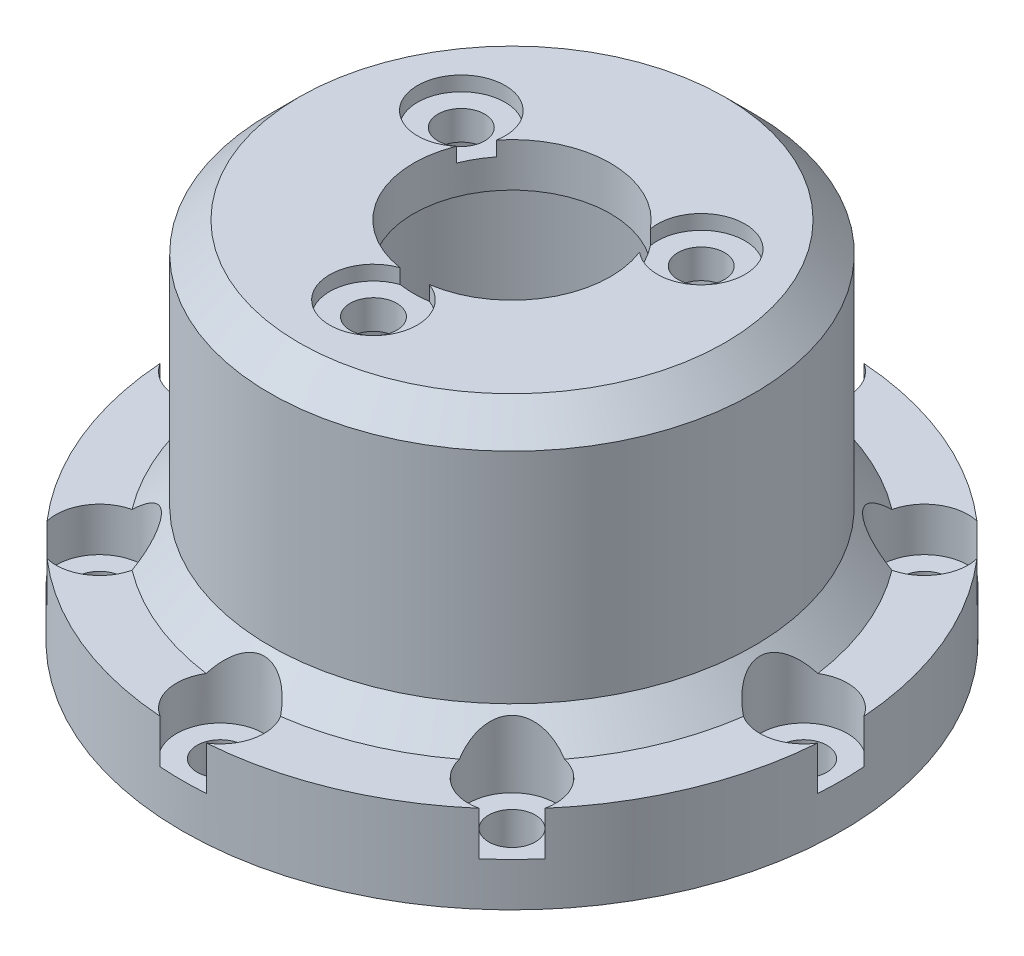
from build123d import *

# Parameters (mm, degrees)
SKETCH_2_R               = 1.6
CUT_EXTRUDE_1_DEPTH      = 8
PATTERN_CIRCULAR_1_COUNT = 8
SKETCH_3_R               = 1.6
CUT_EXTRUDE_2_DEPTH      = 10
SKETCH_4_R               = 3
CUT_EXTRUDE_6_DEPTH      = 3
PATTERN_CIRCULAR_2_COUNT = 8
SKETCH_5_R               = 3
CUT_EXTRUDE_7_DEPTH      = 1
PATTERN_CIRCULAR_3_COUNT = 3
CHAMFER_1_SIZE           = 2


with BuildPart() as part:
    # 草图1 → 旋转1 (revolve)
    with BuildSketch(Plane.XY, mode=Mode.PRIVATE) as revolve_1_sk:
        Polygon((-14, 0), (-16.6, 0), (-16.6, 3), (-22.6, 3), (-22.6, 9), (-16.6, 9), (-16.6, 28), (-6.75, 28), (-6.75, 25), (-14, 25), align=None)
    revolve(revolve_1_sk.sketch.rotate(Axis((0, 0, 0), (0, 1, 0)), 270), axis=Axis((0, 0, 0), (0, 1, 0)))

    # 草图2 → 切除-拉伸1 (cut)
    with BuildSketch(Plane.XZ.offset(-3)):
        with Locations(Location((0, -20, 0), (0, 0, 270))):
            Circle(SKETCH_2_R)
    cut_extrude_1 = extrude(amount=-CUT_EXTRUDE_1_DEPTH, mode=Mode.SUBTRACT)

    # 阵列(圆周)1: 切除-拉伸1 ×8 about axis
    pattern_circular_1_axis = Axis((0, 0, 0), (0, 1, 0))
    for i in range(1, PATTERN_CIRCULAR_1_COUNT):
        add(cut_extrude_1.rotate(pattern_circular_1_axis, i * 360 / PATTERN_CIRCULAR_1_COUNT), mode=Mode.SUBTRACT)

    # 草图3 → 切除-拉伸2 (cut)
    with BuildSketch(Plane(origin=(0, 28, 0), x_dir=(1, 0, 0), z_dir=(0, 1, 0))):
        with Locations(Location((0, -9.5, 0), (0, 0, 270))):
            Circle(SKETCH_3_R)
        with Locations(Location((-8.227241336, 4.75, 0), (0, 0, 270))):
            Circle(SKETCH_3_R)
        with Locations(Location((8.227241336, 4.75, 0), (0, 0, 270))):
            Circle(SKETCH_3_R)
    extrude(amount=-CUT_EXTRUDE_2_DEPTH, mode=Mode.SUBTRACT)

    # 草图4 → 切除-拉伸6 (cut)
    with BuildSketch(Plane(origin=(0, 9, 0), x_dir=(1, 0, 0), z_dir=(0, 1, 0))):
        with Locations((20, 0)):
            Circle(SKETCH_4_R)
    cut_extrude_6 = extrude(amount=-CUT_EXTRUDE_6_DEPTH, mode=Mode.SUBTRACT)

    # 阵列(圆周)2: 切除-拉伸6 ×8 about axis
    pattern_circular_2_axis = Axis((0, 0, 0), (0, 1, 0))
    for i in range(1, PATTERN_CIRCULAR_2_COUNT):
        add(cut_extrude_6.rotate(pattern_circular_2_axis, i * 360 / PATTERN_CIRCULAR_2_COUNT), mode=Mode.SUBTRACT)

    # 草图5 → 切除-拉伸7 (cut)
    with BuildSketch(Plane(origin=(0, 28, 0), x_dir=(1, 0, 0), z_dir=(0, 1, 0))):
        with Locations((8.227241336, 4.75)):
            Circle(SKETCH_5_R)
    cut_extrude_7 = extrude(amount=-CUT_EXTRUDE_7_DEPTH, mode=Mode.SUBTRACT)

    # 阵列(圆周)3: 切除-拉伸7 ×3 about axis
    pattern_circular_3_axis = Axis((0, 0, 0), (0, 1, 0))
    for i in range(1, PATTERN_CIRCULAR_3_COUNT):
        add(cut_extrude_7.rotate(pattern_circular_3_axis, i * 360 / PATTERN_CIRCULAR_3_COUNT), mode=Mode.SUBTRACT)

    # 倒角1
    # the kernel refuses this chamfer: 2 mm, written as the material it adds along each edge
    with BuildSketch(Plane(origin=(0, 9, 0), x_dir=(0, 0, -1), z_dir=(1, 0, 0))) as chamfer_1_piece_1_section:
        Polygon((16.6 + CHAMFER_1_SIZE, 0), (16.6, CHAMFER_1_SIZE), (16.6, 0), align=None)
    chamfer_1_piece_1 = revolve(axis=Axis((0, 9, 0), (0, 1, 0)), mode=Mode.PRIVATE)
    chamfer_1_piece_1 = chamfer_1_piece_1 - Plane(origin=(-14.142135624, 9.253857846, 14.142135624), x_dir=(-0.7071067811865477, 0, 0.7071067811865475), z_dir=(0, 1, 0)) * Cylinder(3, 75, mode=Mode.PRIVATE)
    chamfer_1_piece_1 = chamfer_1_piece_1 - Plane(origin=(20, 9.253857846, 0), x_dir=(1, 0, 0), z_dir=(0, 1, 0)) * Cylinder(3, 75, mode=Mode.PRIVATE)
    chamfer_1_piece_1 = chamfer_1_piece_1 - Plane(origin=(14.142135624, 9.253857846, 14.142135624), x_dir=(0.7071067811865474, 0, 0.7071067811865477), z_dir=(0, 1, 0)) * Cylinder(3, 75, mode=Mode.PRIVATE)
    chamfer_1_piece_1 = chamfer_1_piece_1 - Plane(origin=(0, 9.253857846, 20), x_dir=(0, 0, 1), z_dir=(0, 1, 0)) * Cylinder(3, 75, mode=Mode.PRIVATE)
    chamfer_1_piece_1 = chamfer_1_piece_1 - Plane(origin=(-20, 9.253857846, 0), x_dir=(-1, 0, 0), z_dir=(0, 1, 0)) * Cylinder(3, 75, mode=Mode.PRIVATE)
    chamfer_1_piece_1 = chamfer_1_piece_1 - Plane(origin=(-14.142135624, 9.253857846, -14.142135624), x_dir=(-0.7071067811865475, 0, -0.7071067811865476), z_dir=(0, 1, 0)) * Cylinder(3, 75, mode=Mode.PRIVATE)
    chamfer_1_piece_1 = chamfer_1_piece_1 - Plane(origin=(0, 9.253857846, -20), x_dir=(0, 0, -1), z_dir=(0, 1, 0)) * Cylinder(3, 75, mode=Mode.PRIVATE)
    chamfer_1_piece_1 = chamfer_1_piece_1 - Plane(origin=(14.142135624, 9.253857846, -14.142135624), x_dir=(0.7071067811865476, 0, -0.7071067811865475), z_dir=(0, 1, 0)) * Cylinder(3, 75, mode=Mode.PRIVATE)
    add(chamfer_1_piece_1)
    # the kernel refuses this chamfer: 2 mm, written as the material it takes off along each edge
    with BuildSketch(Plane(origin=(0, 28, 0), x_dir=(0, 0, -1), z_dir=(1, 0, 0))) as chamfer_1_2_piece_1:
        Polygon((16.6 - CHAMFER_1_SIZE, 0), (16.6, -CHAMFER_1_SIZE), (16.6, 0), align=None)
    revolve(axis=Axis((0, 28, 0), (0, 1, 0)), mode=Mode.SUBTRACT)


solid = part.part
